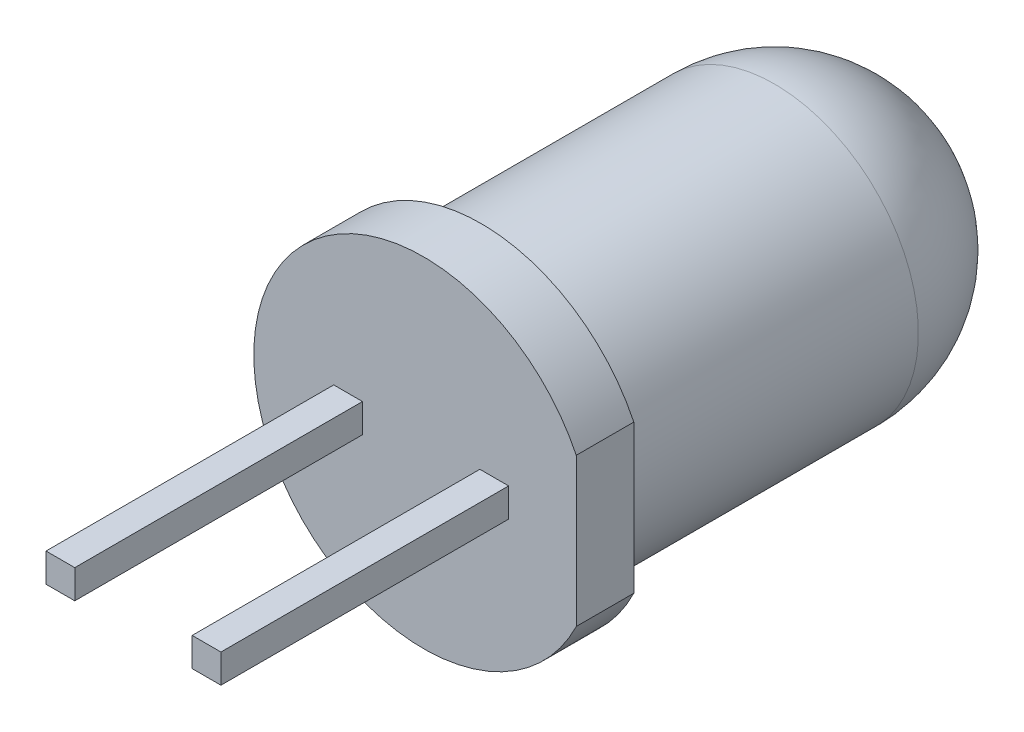
from build123d import *

# Parameters (mm, degrees)
SKETCH2_W           = 0.5
SKETCH2_H           = 0.5
BOSS_EXTRUDE1_DEPTH = 5
CUT_EXTRUDE1_REACH  = 11.565


with BuildPart() as part:
    # Sketch1 → Revolve3 (revolve)
    with BuildSketch(Plane(origin=(0, 0, 0), x_dir=(1, 0, 0), z_dir=(0, 1, 0))):
        with BuildLine():
            Line((-2.908575581, -1.31875), (0.041424419, -1.31875))
            Line((0.041424419, -1.31875), (0.041424419, -1.01875))
            Line((0.041424419, -1.01875), (-0.258575581, -1.01875))
            Line((-0.258575581, -1.01875), (-2.608575581, -1.01875))
            Line((-2.608575581, -1.01875), (-2.608575581, -0.61875))
            Line((-2.608575581, -0.61875), (-2.158575581, -0.61875))
            Line((-2.158575581, -0.61875), (-2.158575581, 4.78125))
            ThreePointArc((-2.158575581, 4.78125), (-1.616887977, 6.226933229), (-0.258575581, 6.960699472))
            Line((-0.258575581, 6.960699472), (0.041424419, 6.960699472))
            Line((0.041424419, 6.960699472), (0.041424419, 7.28125))
            ThreePointArc((0.041424419, 7.28125), (-1.726342534, 6.549016953), (-2.458575581, 4.78125))
            Line((-2.458575581, 4.78125), (-2.458575581, -0.31875))
            Line((-2.458575581, -0.31875), (-2.908575581, -0.31875))
            Line((-2.908575581, -0.31875), (-2.908575581, -1.31875))
        make_face()
    revolve(axis=Axis((0.041424419, 0, -7.28125), (0, 0, 1)))

    # Sketch2 → Boss-Extrude1 (add)
    with BuildSketch(Plane.XY.offset(1.31875)):
        with Locations((1.27, -0.01024953)):
            Rectangle(SKETCH2_W, SKETCH2_H)
        with Locations((-1.27, -0.01024953)):
            Rectangle(SKETCH2_W, SKETCH2_H)
    extrude(amount=BOSS_EXTRUDE1_DEPTH)

    # Sketch3 → Cut-Extrude1 (cut, up to next)
    with BuildSketch(Plane(origin=(0.020061741, 0, 1.31875), x_dir=(1, 0, 0), z_dir=(0, 0, 1)), mode=Mode.PRIVATE) as cut_extrude1_sk1:
        Polygon((2.675232006, 2.192680339), (2.675232006, -2.268878516), (4.29481628, -2.502381421), (4.160489908, 2.299424082), align=None)
    cut_extrude1_tool1 = extrude(cut_extrude1_sk1.sketch, amount=-CUT_EXTRUDE1_REACH, mode=Mode.PRIVATE) & part.part
    add(cut_extrude1_tool1.solids().sort_by_distance((3.481327, -0.10236, 1.31875))[0], mode=Mode.SUBTRACT)


solid = part.part
